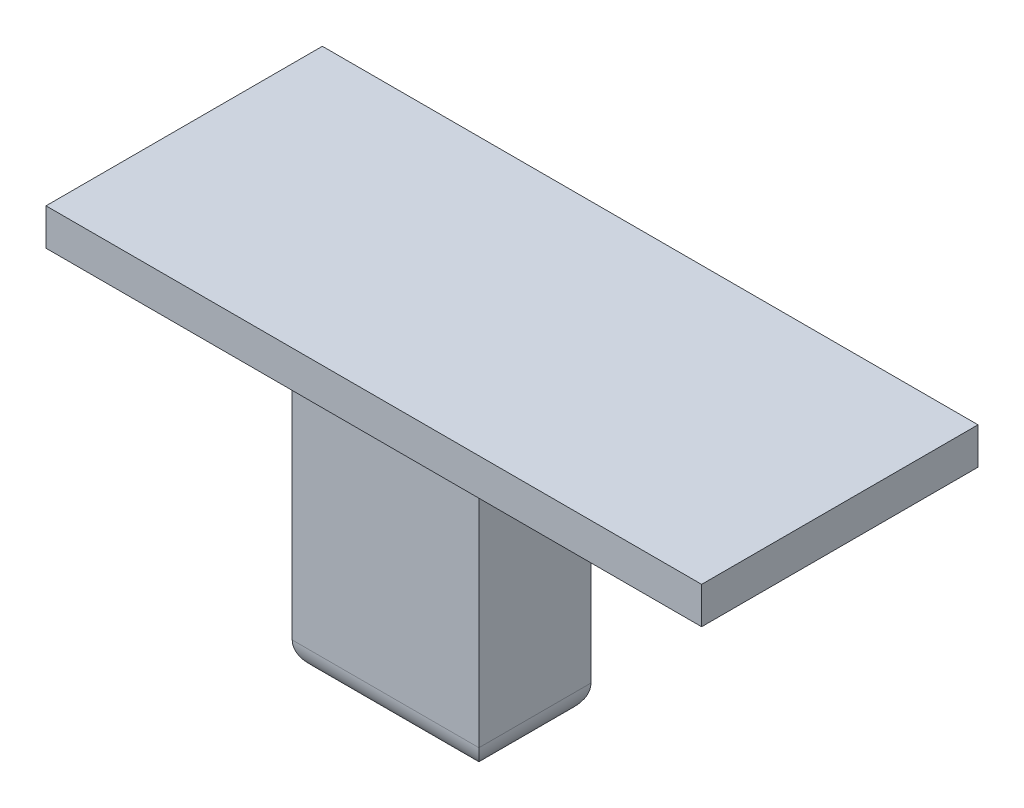
from build123d import *

# Parameters (mm, degrees)
SKETCH1_W           = 44.6
SKETCH1_H           = 18.8
BOSS_EXTRUDE1_DEPTH = 2.5
SKETCH2_W           = 12.7
SKETCH2_H           = 7.62
BOSS_EXTRUDE2_DEPTH = 20
FILLET1_R           = 2
FILLET2_R           = 0.5


with BuildPart() as part:
    # Sketch1 → Boss-Extrude1 (new body)
    with BuildSketch(Plane(origin=(0, 0, 0), x_dir=(1, 0, 0), z_dir=(0, 1, 0))):
        with Locations((0, 6.6)):
            Rectangle(SKETCH1_W, SKETCH1_H)
    extrude(amount=-BOSS_EXTRUDE1_DEPTH)

    # Sketch2 → Boss-Extrude2 (add)
    with BuildSketch(Plane(origin=(0, 0, 0), x_dir=(1, 0, 0), z_dir=(0, 1, 0))):
        with Locations((0, 1.81)):
            Rectangle(SKETCH2_W, SKETCH2_H)
    extrude(amount=-BOSS_EXTRUDE2_DEPTH)

    # Fillet1
    fillet1_edges = [part.edges().sort_by_distance(p)[0] for p in [
        (0, -20, -5.62),
        (-6.35, -20, -1.81),
        (0, -20, 2),
        (6.35, -20, -1.81),
    ]]
    fillet(fillet1_edges, radius=FILLET1_R)

    # Fillet2
    fillet2_edges = [part.edges().sort_by_distance(p)[0] for p in [
        (-6.35, -2.5, -1.81),
        (0, -2.5, 2),
        (0, -2.5, -5.62),
        (6.35, -2.5, -1.81),
    ]]
    fillet(fillet2_edges, radius=FILLET2_R)


solid = part.part
